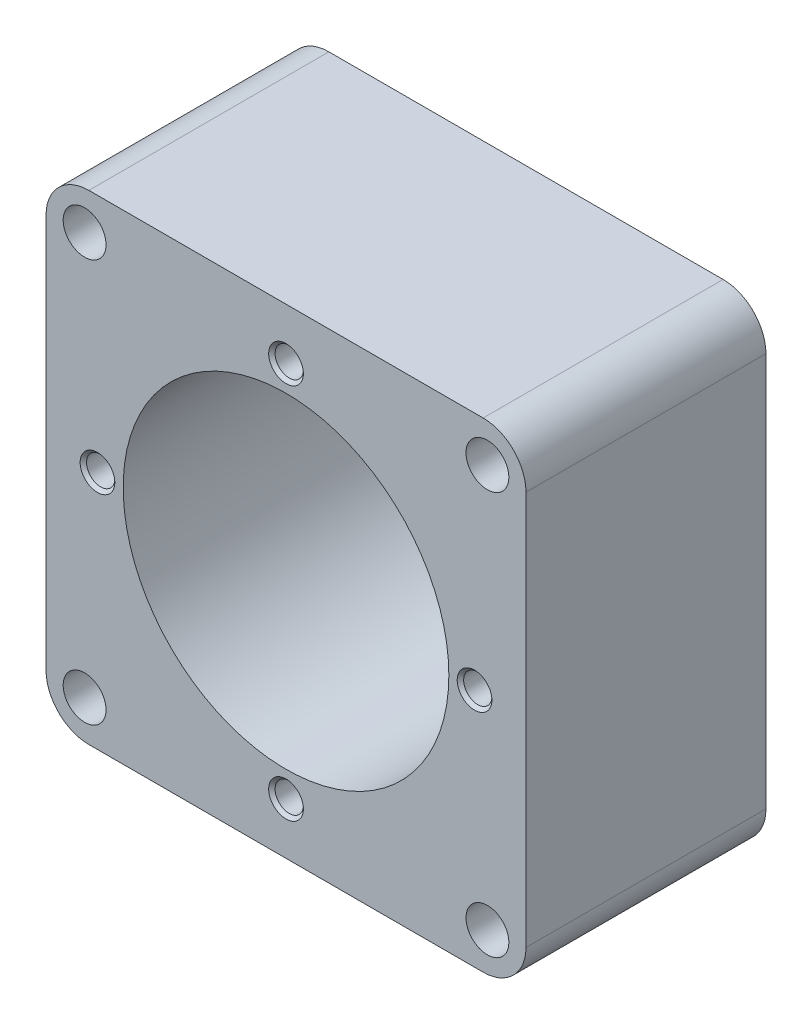
from build123d import *

# Parameters (mm, degrees)
SKETCH1_W                       = 56
SKETCH1_H                       = 56
BASE_FLANGE1_DEPTH              = 28
SKETCH6_R                       = 19
SKETCH6_R_2                     = 2.5
CUT_EXTRUDE1_DEPTH              = 49.497422612
FILLET1_R                       = 5
M4X0_7_TAPPED_HOLE1_D           = 3.3
M4X0_7_TAPPED_HOLE1_DEPTH       = 12.1
M4X0_7_TAPPED_HOLE1_CSINK_D     = 4.05
M4X0_7_TAPPED_HOLE1_CSINK_ANGLE = 90
M4X0_7_TAPPED_HOLE1_TIP         = 0.991420021


# Sheet-metal steps are written as plain solids
with BuildPart() as part:
    # Sketch1 → Base-Flange1 (new body)
    with BuildSketch(Plane.XY):
        Rectangle(SKETCH1_W, SKETCH1_H)
    extrude(amount=-BASE_FLANGE1_DEPTH)

    # Sketch6 → Cut-Extrude1 (cut, through all)
    with BuildSketch(Plane.XY):
        Circle(SKETCH6_R)
        with Locations((-23.5, 23.5)):
            Circle(SKETCH6_R_2)
        with Locations((23.5, 23.5)):
            Circle(SKETCH6_R_2)
        with Locations((23.5, -23.5)):
            Circle(SKETCH6_R_2)
        with Locations((-23.5, -23.5)):
            Circle(SKETCH6_R_2)
    extrude(amount=-CUT_EXTRUDE1_DEPTH, mode=Mode.SUBTRACT)

    # Fillet1
    fillet1_edges = [part.edges().sort_by_distance(p)[0] for p in [
        (28, -28, -14),
        (-28, -28, -14),
        (-28, 28, -14),
        (28, 28, -14),
    ]]
    fillet(fillet1_edges, radius=FILLET1_R)

    # M4x0.7 Tapped Hole1
    with Locations(Plane.XY):
        with Locations((0, 22), (-22, 0), (0, -22), (22, 0)):
            CounterSinkHole(M4X0_7_TAPPED_HOLE1_D / 2, M4X0_7_TAPPED_HOLE1_CSINK_D / 2, depth=M4X0_7_TAPPED_HOLE1_DEPTH, counter_sink_angle=M4X0_7_TAPPED_HOLE1_CSINK_ANGLE)
            with Locations((0, 0, -(M4X0_7_TAPPED_HOLE1_DEPTH + M4X0_7_TAPPED_HOLE1_TIP / 2))):  # 118° drill point
                Cone(0, M4X0_7_TAPPED_HOLE1_D / 2, M4X0_7_TAPPED_HOLE1_TIP, mode=Mode.SUBTRACT)


solid = part.part
